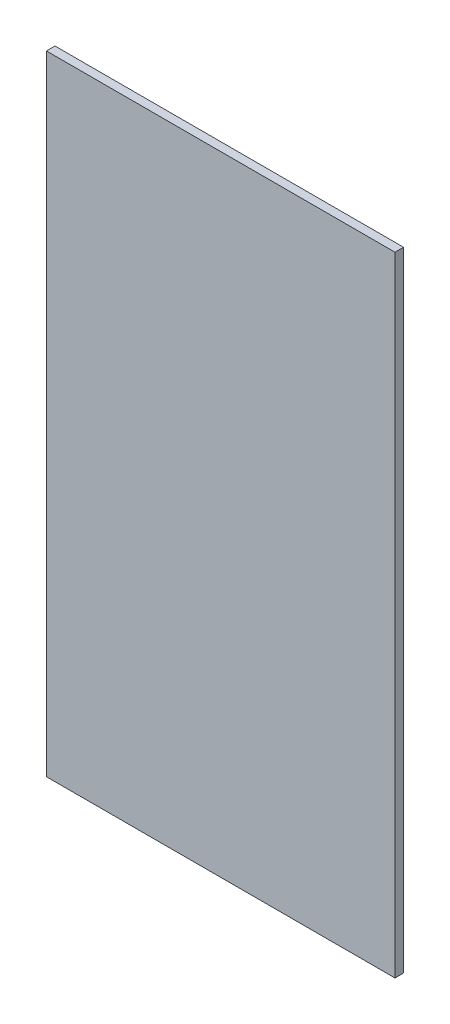
from build123d import *

# Parameters (mm, degrees)
SKETCH1_W           = 122
SKETCH1_H           = 220
BOSS_EXTRUDE1_DEPTH = 3


with BuildPart() as part:
    # Sketch1 → Boss-Extrude1 (new body)
    with BuildSketch(Plane.XY):
        Rectangle(SKETCH1_W, SKETCH1_H)
    extrude(amount=BOSS_EXTRUDE1_DEPTH)


solid = part.part
